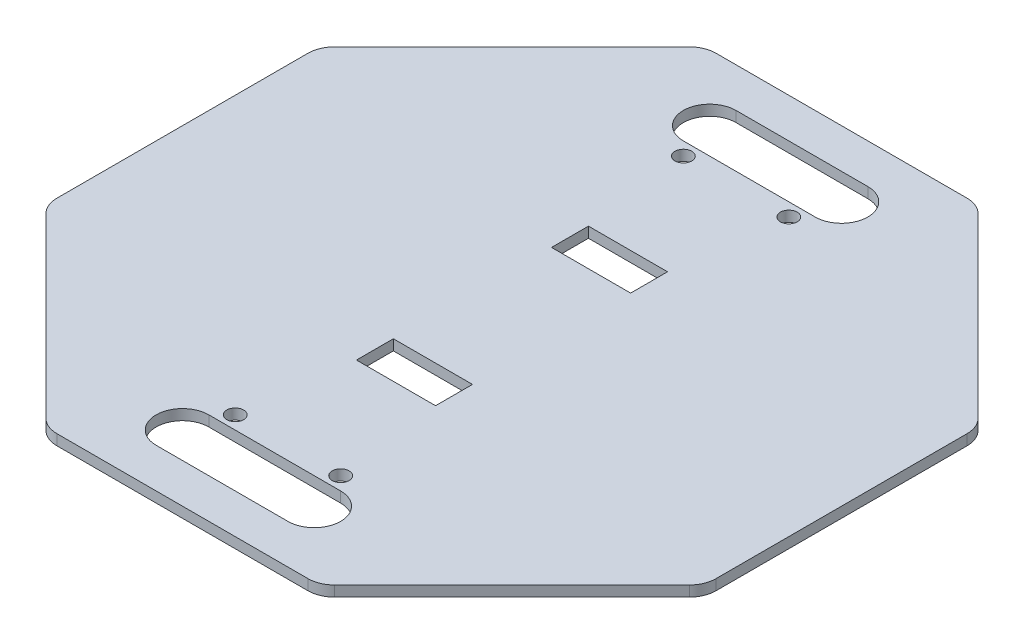
from build123d import *

# Parameters (mm, degrees)
SKETCH1_R           = 1.6
SKETCH1_W           = 15
SKETCH1_H           = 7
BOSS_EXTRUDE1_DEPTH = 2
FILLET1_R           = 5


with BuildPart() as part:
    # Sketch1 → Boss-Extrude1 (new body)
    with BuildSketch(Plane(origin=(0, 0, 0), x_dir=(1, 0, 0), z_dir=(0, 1, 0))):
        Polygon((62.5, -25.888347648), (62.5, 25.888347648), (25.888347648, 62.5), (-25.888347648, 62.5), (-62.5, 25.888347648), (-62.5, -25.888347648), (-25.888347648, -62.5), (25.888347648, -62.5), align=None)
        with Locations((-10, -42.5)):
            Circle(SKETCH1_R, mode=Mode.SUBTRACT)
        with BuildLine():
            ThreePointArc((12.5, -45), (17.5, -50), (12.5, -55))
            Line((12.5, -55), (-12.5, -55))
            ThreePointArc((-12.5, -55), (-17.5, -50), (-12.5, -45))
            Line((-12.5, -45), (12.5, -45))
        make_face(mode=Mode.SUBTRACT)
        with Locations((10, -42.5)):
            Circle(SKETCH1_R, mode=Mode.SUBTRACT)
        with Locations((0, -18.5)):
            Rectangle(SKETCH1_W, SKETCH1_H, mode=Mode.SUBTRACT)
        with Locations((-10, 42.5)):
            Circle(SKETCH1_R, mode=Mode.SUBTRACT)
        with Locations((0, 18.5)):
            Rectangle(SKETCH1_W, SKETCH1_H, mode=Mode.SUBTRACT)
        with BuildLine():
            Line((-12.5, 55), (12.5, 55))
            ThreePointArc((12.5, 55), (17.5, 50), (12.5, 45))
            Line((12.5, 45), (-12.5, 45))
            ThreePointArc((-12.5, 45), (-17.5, 50), (-12.5, 55))
        make_face(mode=Mode.SUBTRACT)
        with Locations((10, 42.5)):
            Circle(SKETCH1_R, mode=Mode.SUBTRACT)
    extrude(amount=BOSS_EXTRUDE1_DEPTH)

    # Fillet1
    fillet1_edges = [part.edges().sort_by_distance(p)[0] for p in [
        (-25.888347648, 1, 62.5),
        (-62.5, 1, 25.888347648),
        (-62.5, 1, -25.888347648),
        (-25.888347648, 1, -62.5),
        (25.888347648, 1, -62.5),
        (62.5, 1, -25.888347648),
        (62.5, 1, 25.888347648),
        (25.888347648, 1, 62.5),
    ]]
    fillet(fillet1_edges, radius=FILLET1_R)


solid = part.part
